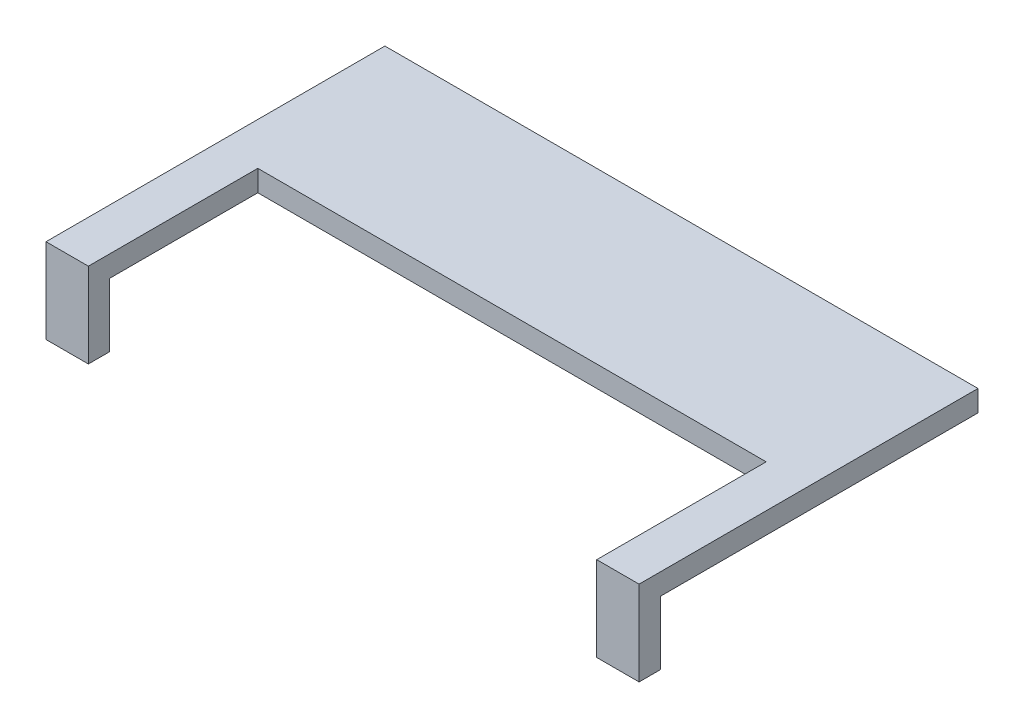
from build123d import *

# Parameters (mm, degrees)
SKETCH1_W           = 177.8
SKETCH1_H           = 101.6
BOSS_EXTRUDE1_DEPTH = 6.35
SKETCH2_W           = 12.7
SKETCH2_H           = 25.4
BOSS_EXTRUDE2_DEPTH = 6.35
SKETCH3_W           = 152.4
SKETCH3_H           = 50.8
CUT_EXTRUDE1_DEPTH  = 106.494123059


with BuildPart() as part:
    # Sketch1 → Boss-Extrude1 (new body)
    with BuildSketch(Plane(origin=(0, 0, 0), x_dir=(1, 0, 0), z_dir=(0, 1, 0))):
        Rectangle(SKETCH1_W, SKETCH1_H)
    extrude(amount=BOSS_EXTRUDE1_DEPTH)

    # Sketch2 → Boss-Extrude2 (add)
    with BuildSketch(Plane.XY.offset(50.8)):
        with Locations((-82.55, -6.35)):
            Rectangle(SKETCH2_W, SKETCH2_H)
    boss_extrude2 = extrude(amount=-BOSS_EXTRUDE2_DEPTH)

    # Mirror1: Boss-Extrude2 across plane
    add(boss_extrude2.mirror(Plane(origin=(0, 0, 0), x_dir=(0, 0, 1), z_dir=(1, 0, 0))))

    # Sketch3 → Cut-Extrude1 (cut, through all)
    with BuildSketch(Plane(origin=(0, 6.35, 0), x_dir=(1, 0, 0), z_dir=(0, 1, 0))):
        with Locations((0, -25.4)):
            Rectangle(SKETCH3_W, SKETCH3_H)
    extrude(amount=-CUT_EXTRUDE1_DEPTH, mode=Mode.SUBTRACT)


solid = part.part
